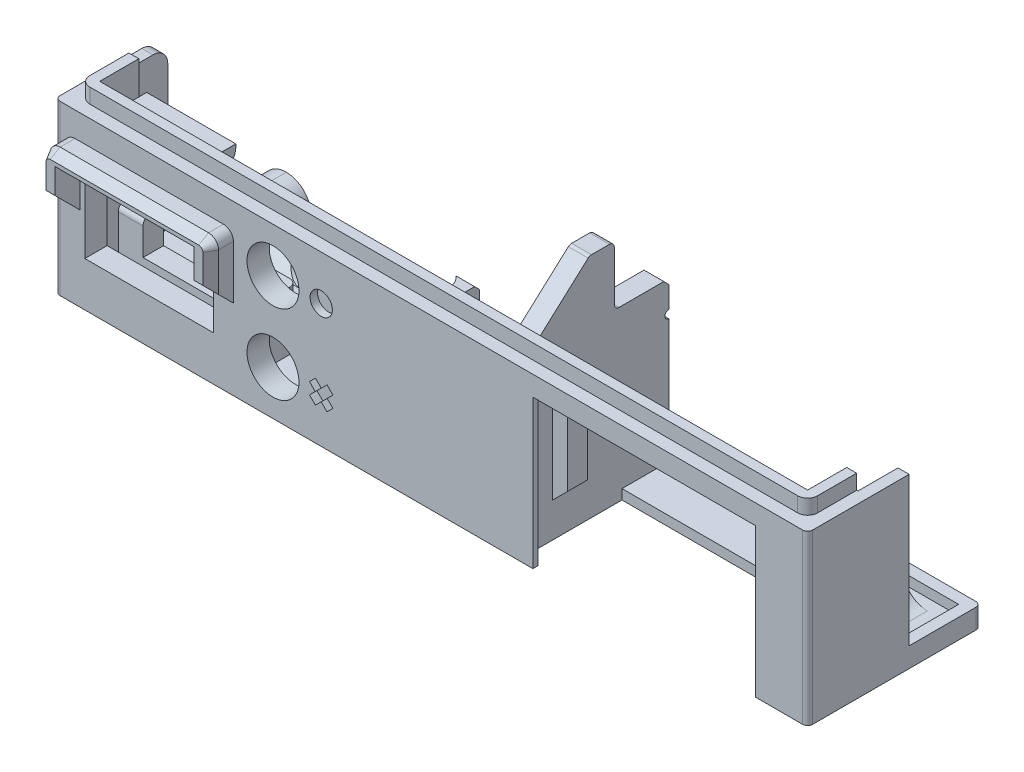
from build123d import *
from OCP.BRepFilletAPI import BRepFilletAPI_MakeChamfer

# Parameters (mm, degrees)
ESBO_O1_W                     = 152
ESBO_O1_H                     = 35
RESSALTO_EXTRUS_O1_DEPTH      = 2
ESBO_O3_W                     = 152
ESBO_O3_H                     = 35
RESSALTO_EXTRUS_O2_DEPTH      = 32
CORTE_EXTRUS_O1_DEPTH         = 30
FILETE2_R                     = 3
FILETE3_R                     = 1
ESBO_O7_R                     = 5.25
ESBO_O7_W                     = 26
ESBO_O7_H                     = 16
CORTE_EXTRUS_O2_DEPTH         = 4.5
ESBO_O8_R                     = 2.25
CORTE_EXTRUS_O3_DEPTH         = 1.5
ESBO_O10_W                    = 51
ESBO_O10_H                    = 21
CORTE_EXTRUS_O5_DEPTH         = 30
ESBO_O12_W                    = 14
ESBO_O12_H                    = 19.5
ESBO_O12_W_2                  = 8
ESBO_O12_H_2                  = 6
CORTE_EXTRUS_O7_DEPTH         = 16
RESSALTO_EXTRUS_O4_DEPTH      = 12
FILETE16_R                    = 1.5
CHANFRO2_SIZE                 = 1
RESSALTO_EXTRUS_O6_DEPTH      = 29
RESSALTO_EXTRUS_O6_DEPTH_BACK = 1
RESSALTO_EXTRUS_O6_START      = -1.5
RESSALTO_EXTRUS_O13_DEPTH     = 3
RESSALTO_EXTRUS_O14_DEPTH     = 34
RESSALTO_EXTRUS_O15_START     = 8
ESBO_O35_W                    = 3
ESBO_O35_H                    = 4
ESBO_O35_W_2                  = 6
ESBO_O35_H_2                  = 5.4
RESSALTO_EXTRUS_O15_DEPTH     = 15
CHANFRO3_SIZE                 = 3
CHANFRO4_SIZE                 = 6
CHANFRO5_SIZE                 = 6
CHANFRO6_SIZE                 = 3
ESBO_O36_W                    = 10
ESBO_O36_H                    = 4
RESSALTO_EXTRUS_O16_DEPTH     = 12
FILETE20_R                    = 5
CHANFRO7_SIZE                 = 3
ESBO_O37_R                    = 1.25
CORTE_EXTRUS_O8_DEPTH         = 159.658761183
RESSALTO_EXTRUS_O17_DEPTH     = 4
FILETE21_R                    = 1
FILETE22_R                    = 1
FILETE23_R                    = 2
CORTE_EXTRUS_O9_DEPTH         = 4
ESBO_O40_W                    = 5
ESBO_O40_H                    = 4.15
RESSALTO_EXTRUS_O19_DEPTH     = 11.8
FILETE24_R                    = 1.5
ESBO_O42_W                    = 18
ESBO_O42_H                    = 4
RESSALTO_EXTRUS_O20_DEPTH     = 4
FILETE25_R                    = 3.5
RESSALTO_EXTRUS_O21_DEPTH     = 5
CHANFRO8_SIZE                 = 5
CHANFRO9_SIZE                 = 3
CHANFRO9_SIZE2                = 1.091910703
FILETE26_R                    = 2
CHANFRO10_SIZE                = 2
CHANFRO10_SIZE2               = 1.154700538


with BuildPart() as part:
    # Esboço1 → Ressalto-extrusão1 (new body)
    with BuildSketch(Plane(origin=(0, 0, 0), x_dir=(1, 0, 0), z_dir=(0, 1, 0))):
        with Locations((76, 17.5)):
            Rectangle(ESBO_O1_W, ESBO_O1_H)
    extrude(amount=RESSALTO_EXTRUS_O1_DEPTH)

    # Esboço3 → Ressalto-extrusão2 (add)
    with BuildSketch(Plane(origin=(0, 2, 0), x_dir=(1, 0, 0), z_dir=(0, 1, 0))):
        with Locations((76, 17.5)):
            Rectangle(ESBO_O3_W, ESBO_O3_H)
        Polygon((4.5, 12.4), (4.5, 4.5), (89.5, 4.5), (89.5, 30.45), (93.5, 30.45), (93.5, 4.5), (147.5, 4.5), (147.5, 12.4), (149.75, 12.4), (149.75, 32.75), (2.25, 32.75), (2.25, 12.4), align=None, mode=Mode.SUBTRACT)
    extrude(amount=RESSALTO_EXTRUS_O2_DEPTH)

    # Esboço5 → Corte-extrusão1 (cut)
    with BuildSketch(Plane(origin=(0, 34, 0), x_dir=(1, 0, 0), z_dir=(0, 1, 0))):
        Polygon((0, 35), (152, 35), (152, 20.5), (149.75, 20.5), (149.75, 32.75), (2.25, 32.75), (2.25, 20.5), (0, 20.5), align=None)
    extrude(amount=-CORTE_EXTRUS_O1_DEPTH, mode=Mode.SUBTRACT)

    # Filete2
    filete2_edges = [part.edges().sort_by_distance(p)[0] for p in [
        (1.125, 34, -20.5),
    ]]
    fillet(filete2_edges, radius=FILETE2_R)

    # Filete3
    filete3_edges = [part.edges().sort_by_distance(p)[0] for p in [
        (0, 2, -35),
        (152, 2, -35),
        (152, 17, 0),
        (0, 17, 0),
    ]]
    fillet(filete3_edges, radius=FILETE3_R)

    # Esboço7 → Corte-extrusão2 (cut)
    with BuildSketch(Plane.XY):
        with Locations((44, 25)):
            Circle(ESBO_O7_R)
        with Locations((44, 9)):
            Circle(ESBO_O7_R)
        with Locations((19, 17)):
            Rectangle(ESBO_O7_W, ESBO_O7_H)
    extrude(amount=-CORTE_EXTRUS_O2_DEPTH, mode=Mode.SUBTRACT)

    # Esboço8 → Corte-extrusão3 (cut)
    with BuildSketch(Plane.XY):
        with Locations((53.75, 25)):
            Circle(ESBO_O8_R)
        Polygon((52.583273916, 11.368807769), (53.750000059, 10.202081537), (54.916726239, 11.368807692), (56.118807717, 10.16672619), (54.952081503, 9), (56.118807679, 7.833273734), (54.916726084, 6.631192231), (53.749999941, 7.797918463), (52.583273761, 6.631192308), (51.381192283, 7.83327381), (52.547918497, 9), (51.381192321, 10.166726266), align=None)
    extrude(amount=-CORTE_EXTRUS_O3_DEPTH, mode=Mode.SUBTRACT)

    # Esboço10 → Corte-extrusão5 (cut)
    with BuildSketch(Plane.XZ):
        with Locations((119, -10.5)):
            Rectangle(ESBO_O10_W, ESBO_O10_H)
    extrude(amount=-CORTE_EXTRUS_O5_DEPTH, mode=Mode.SUBTRACT)

    # Esboço12 → Corte-extrusão7 (cut)
    with BuildSketch(Plane.XZ):
        with Locations((81.5, -18)):
            Rectangle(ESBO_O12_W, ESBO_O12_H)
        with BuildLine():
            Line((55.75, -18.402380053), (55.75, -12.097619947))
            ThreePointArc((55.75, -12.097619947), (62, -8.25), (68.25, -12.097619947))
            Line((68.25, -12.097619947), (68.25, -18.402380053))
            ThreePointArc((68.25, -18.402380053), (62, -22.25), (55.75, -18.402380053))
        make_face()
        with Locations((62, -32)):
            Rectangle(ESBO_O12_W_2, ESBO_O12_H_2)
    extrude(amount=-CORTE_EXTRUS_O7_DEPTH, mode=Mode.SUBTRACT)

    # Esboço15 → Ressalto-extrusão4 (add)
    with BuildSketch(Plane(origin=(0, 2, 0), x_dir=(1, 0, 0), z_dir=(0, 1, 0))):
        with BuildLine():
            Line((68.619154519, 22.35), (67.119154519, 23.85))
            Line((67.119154519, 23.85), (67.119154519, 24.75))
            Line((67.119154519, 24.75), (68.823336518, 24.75))
            Line((68.823336518, 24.75), (68.823336518, 30.45))
            Line((68.823336518, 30.45), (72.823336518, 30.45))
            Line((72.823336518, 30.45), (72.823336518, 29.65))
            ThreePointArc((72.823336518, 29.65), (71.645627754, 28.238854382), (71.223336518, 26.45))
            Line((71.223336518, 26.45), (71.223336518, 22.35))
            Line((71.223336518, 22.35), (68.619154519, 22.35))
        make_face()
        with BuildLine():
            Line((55.287058032, 24.75), (55.287058032, 30.45))
            Line((55.287058032, 30.45), (51.287058032, 30.45))
            Line((51.287058032, 30.45), (51.287058032, 29.65))
            ThreePointArc((51.287058032, 29.65), (52.464766796, 28.238854382), (52.887058032, 26.45))
            Line((52.887058032, 26.45), (52.887058032, 22.35))
            Line((52.887058032, 22.35), (55.491240032, 22.35))
            Line((55.491240032, 22.35), (56.991240032, 23.85))
            Line((56.991240032, 23.85), (56.991240032, 24.75))
            Line((56.991240032, 24.75), (55.287058032, 24.75))
        make_face()
    extrude(amount=RESSALTO_EXTRUS_O4_DEPTH)

    # Filete16
    filete16_edges = [part.edges().sort_by_distance(p)[0] for p in [
        (51.287058032, 2, -30.05),
        (52.464766796, 2, -28.238854382),
        (52.887058032, 2, -24.4),
        (54.189149032, 2, -22.35),
        (56.241240032, 2, -23.1),
        (56.991240032, 2, -24.3),
        (67.119154519, 2, -24.3),
        (67.869154519, 2, -23.1),
        (69.921245519, 2, -22.35),
        (71.223336518, 2, -24.4),
        (71.645627754, 2, -28.238854382),
        (72.823336518, 2, -30.05),
    ]]
    fillet(filete16_edges, radius=FILETE16_R)

    # Chanfro2
    chanfro2_edges = [part.edges().sort_by_distance(p)[0] for p in [
        (91.5, 34, -30.45),
        (70.823336518, 14, -30.45),
        (53.287058032, 14, -30.45),
    ]]
    chamfer(chanfro2_edges, length=CHANFRO2_SIZE)

    # Esboço18 → Ressalto-extrusão6 (add, two sides: drawn at the far end of the back side and taken through both)
    with BuildSketch(Plane(origin=(6, 0, 0), x_dir=(0, 0, -1), z_dir=(1, 0, 0)).offset(RESSALTO_EXTRUS_O6_START - RESSALTO_EXTRUS_O6_DEPTH_BACK)):
        Polygon((4.5, 3.8), (8.25, 3.8), (8.25, 6.8), (12.4, 6.8), (12.4, 2), (4.5, 2), align=None)
    extrude(amount=RESSALTO_EXTRUS_O6_DEPTH + RESSALTO_EXTRUS_O6_DEPTH_BACK)

    # Esboço31 → Ressalto-extrusão13 (add)
    with BuildSketch(Plane(origin=(0, 34, 0), x_dir=(1, 0, 0), z_dir=(0, 1, 0))):
        Polygon((147.5, 12.4), (149.5, 12.4), (149.5, 2.5), (2.5, 2.5), (2.5, 12.4), (4.5, 12.4), (4.5, 4.5), (147.5, 4.5), align=None)
    extrude(amount=RESSALTO_EXTRUS_O13_DEPTH)

    # Esboço34 → Ressalto-extrusão14 (add)
    with BuildSketch(Plane.XZ):
        Polygon((96.5, -1), (93.5, -4), (93.5, 0), (96.5, 0), align=None)
        Polygon((144.5, 0), (141.5, 0), (141.5, -1), (144.5, -4), align=None)
    extrude(amount=-RESSALTO_EXTRUS_O14_DEPTH)

    # Esboço35 → Ressalto-extrusão15 (add)
    with BuildSketch(Plane(origin=(0, 2, 0), x_dir=(1, 0, 0), z_dir=(0, 1, 0)).offset(RESSALTO_EXTRUS_O15_START)):
        with Locations((95, 9)):
            Rectangle(ESBO_O35_W, ESBO_O35_H)
        with Locations((144.5, 9.7)):
            Rectangle(ESBO_O35_W_2, ESBO_O35_H_2)
    extrude(amount=RESSALTO_EXTRUS_O15_DEPTH)

    # Chanfro3
    chanfro3_edges = [part.edges().sort_by_distance(p)[0] for p in [
        (93.5, 10, -9),
    ]]
    chamfer(chanfro3_edges, length=CHANFRO3_SIZE - 0.0001)  # a hair under: the kernel refuses the full size

    # Chanfro4
    chanfro4_edges = [part.edges().sort_by_distance(p)[0] for p in [
        (147.5, 10, -9.7),
    ]]
    chamfer(chanfro4_edges, length=CHANFRO4_SIZE - 0.0001)  # a hair under: the kernel refuses the full size

    # Chanfro5
    chanfro5_edges = [part.edges().sort_by_distance(p)[0] for p in [
        (147.5, 25, -9.7),
    ]]
    chamfer(chanfro5_edges, length=CHANFRO5_SIZE - 0.0001)  # a hair under: the kernel refuses the full size

    # Chanfro6
    chanfro6_edges = [part.edges().sort_by_distance(p)[0] for p in [
        (93.5, 25, -9),
    ]]
    chamfer(chanfro6_edges, length=CHANFRO6_SIZE - 0.0001)  # a hair under: the kernel refuses the full size

    # Esboço36 → Ressalto-extrusão16 (add)
    with BuildSketch(Plane(origin=(0, 2, 0), x_dir=(1, 0, 0), z_dir=(0, 1, 0))):
        with Locations((16.25, 28.45)):
            Rectangle(ESBO_O36_W, ESBO_O36_H)
        with Locations((135.75, 28.45)):
            Rectangle(ESBO_O36_W, ESBO_O36_H)
    extrude(amount=RESSALTO_EXTRUS_O16_DEPTH)

    # Filete20
    filete20_edges = [part.edges().sort_by_distance(p)[0] for p in [
        (11.25, 2, -28.45),
    ]]
    fillet(filete20_edges, radius=FILETE20_R)
    filete20_2_edges = [part.edges().sort_by_distance(p)[0] for p in [
        (21.25, 2, -28.45),
    ]]
    fillet(filete20_2_edges, radius=FILETE20_R)
    filete20_3_edges = [part.edges().sort_by_distance(p)[0] for p in [
        (130.75, 2, -28.45),
    ]]
    fillet(filete20_3_edges, radius=FILETE20_R)
    filete20_4_edges = [part.edges().sort_by_distance(p)[0] for p in [
        (140.75, 2, -28.45),
    ]]
    fillet(filete20_4_edges, radius=FILETE20_R)
    filete20_5_edges = [part.edges().sort_by_distance(p)[0] for p in [
        (11.25, 14, -28.45),
    ]]
    fillet(filete20_5_edges, radius=FILETE20_R)
    filete20_6_edges = [part.edges().sort_by_distance(p)[0] for p in [
        (21.25, 14, -28.45),
    ]]
    fillet(filete20_6_edges, radius=FILETE20_R - 0.0001)  # a hair under: the kernel refuses the full size
    filete20_7_edges = [part.edges().sort_by_distance(p)[0] for p in [
        (130.75, 14, -28.45),
    ]]
    fillet(filete20_7_edges, radius=FILETE20_R)
    filete20_8_edges = [part.edges().sort_by_distance(p)[0] for p in [
        (140.75, 14, -28.45),
    ]]
    fillet(filete20_8_edges, radius=FILETE20_R - 0.0001)  # a hair under: the kernel refuses the full size

    # Chanfro7
    chanfro7_edges = [part.edges().sort_by_distance(p)[0] for p in [
        (16.25, 2, -26.45),
        (135.75, 2, -26.45),
    ]]
    chamfer(chanfro7_edges, length=CHANFRO7_SIZE)

    # Esboço37 → Corte-extrusão8 (cut, through all)
    with BuildSketch(Plane.XY.offset(-26.45)):
        with Locations((16.25, 9)):
            Circle(ESBO_O37_R)
        with Locations((135.75, 9)):
            Circle(ESBO_O37_R)
    extrude(amount=-CORTE_EXTRUS_O8_DEPTH, mode=Mode.SUBTRACT)

    # Esboço38 → Ressalto-extrusão17 (add)
    with BuildSketch(Plane.ZY.offset(-89.5)):
        Polygon((-19.45, 34), (-19.45, 46), (-14.45, 46), (-4.5, 37), (-4.5, 34), align=None)
    extrude(amount=-RESSALTO_EXTRUS_O17_DEPTH)

    # Filete21
    filete21_edges = [part.edges().sort_by_distance(p)[0] for p in [
        (91.5, 34, -19.45),
    ]]
    fillet(filete21_edges, radius=FILETE21_R)

    # Filete22
    filete22_edges = [part.edges().sort_by_distance(p)[0] for p in [
        (91.5, 46, -14.45),
        (91.5, 46, -19.45),
    ]]
    fillet(filete22_edges, radius=FILETE22_R)

    # Filete23
    filete23_edges = [part.edges().sort_by_distance(p)[0] for p in [
        (2.5, 35.5, -2.5),
        (149.5, 35.5, -2.5),
    ]]
    fillet(filete23_edges, radius=FILETE23_R)

    # Esboço39 → Corte-extrusão9 (cut)
    with BuildSketch(Plane(origin=(93.5, 0, 0), x_dir=(0, 0, -1), z_dir=(1, 0, 0))):
        with BuildLine():
            Line((30.45, 27), (30.45, 28.6))
            ThreePointArc((30.45, 28.6), (29.65, 27.8), (30.45, 27))
        make_face()
    extrude(amount=-CORTE_EXTRUS_O9_DEPTH, mode=Mode.SUBTRACT)

    # Esboço40 → Ressalto-extrusão19 (add)
    with BuildSketch(Plane(origin=(0, 2, 0), x_dir=(1, 0, 0), z_dir=(0, 1, 0))):
        with Locations((7, 10.325)):
            Rectangle(ESBO_O40_W, ESBO_O40_H)
        Polygon((33.5, 4.5), (36.5, 4.5), (36.5, 12.4), (28.5, 12.4), (28.5, 8.25), (33.5, 8.25), align=None)
    extrude(amount=RESSALTO_EXTRUS_O19_DEPTH)

    # Filete24
    filete24_edges = [part.edges().sort_by_distance(p)[0] for p in [
        (7, 13.8, -8.25),
        (36.5, 7.9, -12.4),
        (31, 13.8, -8.25),
    ]]
    fillet(filete24_edges, radius=FILETE24_R)

    # Esboço42 → Ressalto-extrusão20 (add)
    with BuildSketch(Plane(origin=(0, 0, -4.5), x_dir=(-1, 0, 0), z_dir=(0, 0, -1))):
        with Locations((-19, 33.8)):
            Rectangle(ESBO_O42_W, ESBO_O42_H)
    extrude(amount=RESSALTO_EXTRUS_O20_DEPTH)

    # Filete25
    filete25_edges = [part.edges().sort_by_distance(p)[0] for p in [
        (19, 31.8, -8.5),
    ]]
    fillet(filete25_edges, radius=FILETE25_R)

    # Esboço44 → Ressalto-extrusão21 (add)
    with BuildSketch(Plane.XY):
        Polygon((5, 26), (33, 26), (33, 16.207982153), (36, 16.207982153), (36, 29), (2, 29), (2, 17), (5, 17), align=None)
    extrude(amount=RESSALTO_EXTRUS_O21_DEPTH)

    # Chanfro8
    chanfro8_edges = [part.edges().sort_by_distance(p)[0] for p in [
        (34.5, 16.207982153, 5),
        (3.5, 17, 5),
    ]]
    chamfer(chanfro8_edges, length=CHANFRO8_SIZE - 0.0001)  # a hair under: the kernel refuses the full size

    # Chanfro9
    chanfro9_edges = [part.edges().sort_by_distance(p)[0] for p in [
        (19, 26, 5),
    ]]
    chanfro9_side = [part.faces().sort_by_distance(p)[0] for p in [
        (19, 26, 2.5),
    ]]
    chamfer(chanfro9_edges, length=CHANFRO9_SIZE, length2=CHANFRO9_SIZE2, reference=chanfro9_side[0])

    # Filete26
    filete26_edges = [part.edges().sort_by_distance(p)[0] for p in [
        (36, 29, 2.5),
        (2, 29, 2.5),
    ]]
    fillet(filete26_edges, radius=FILETE26_R)

    # Chanfro10: one chamfer whose edges measure the first distance from different faces: ONE call of the kernel's chamfer builder (chamfer() names one face for all edges)
    chanfro10_edges_1 = [part.edges().sort_by_distance(p)[0] for p in [
        (36, 24.103941077, 5),
    ]]
    chanfro10_side_1 = [part.faces().sort_by_distance(p)[0] for p in [
        (36, 22.728319772, 2.24875739),
    ]]
    chanfro10_edges_2 = [part.edges().sort_by_distance(p)[0] for p in [
        (19, 29, 5),
    ]]
    chanfro10_side_2 = [part.faces().sort_by_distance(p)[0] for p in [
        (19, 29, 2.5),
    ]]
    chanfro10_edges_3 = [part.edges().sort_by_distance(p)[0] for p in [
        (2, 24.49995, 5),
    ]]
    chanfro10_side_3 = [part.faces().sort_by_distance(p)[0] for p in [
        (2, 23.111062964, 2.222225926),
    ]]
    chanfro10_edges_4 = [part.edges().sort_by_distance(p)[0] for p in [
        (2.585786438, 28.414213562, 5),
    ]]
    chanfro10_side_4 = [part.faces().sort_by_distance(p)[0] for p in [
        (2.585786438, 28.414213562, 2.5),
    ]]
    chanfro10_edges_5 = [part.edges().sort_by_distance(p)[0] for p in [
        (35.414213562, 28.414213562, 5),
    ]]
    chanfro10_side_5 = [part.faces().sort_by_distance(p)[0] for p in [
        (35.414213562, 28.414213562, 2.5),
    ]]
    chanfro10 = BRepFilletAPI_MakeChamfer(part.part.solid().wrapped)
    for e in chanfro10_edges_1:
        chanfro10.Add(CHANFRO10_SIZE, CHANFRO10_SIZE2, e.wrapped, chanfro10_side_1[0].wrapped)  # the first distance lies on this face
    for e in chanfro10_edges_2:
        chanfro10.Add(CHANFRO10_SIZE, CHANFRO10_SIZE2, e.wrapped, chanfro10_side_2[0].wrapped)  # the first distance lies on this face
    for e in chanfro10_edges_3:
        chanfro10.Add(CHANFRO10_SIZE, CHANFRO10_SIZE2, e.wrapped, chanfro10_side_3[0].wrapped)  # the first distance lies on this face
    for e in chanfro10_edges_4:
        chanfro10.Add(CHANFRO10_SIZE, CHANFRO10_SIZE2, e.wrapped, chanfro10_side_4[0].wrapped)  # the first distance lies on this face
    for e in chanfro10_edges_5:
        chanfro10.Add(CHANFRO10_SIZE, CHANFRO10_SIZE2, e.wrapped, chanfro10_side_5[0].wrapped)  # the first distance lies on this face
    add(Compound.cast(chanfro10.Shape()), mode=Mode.REPLACE)


solid = part.part
